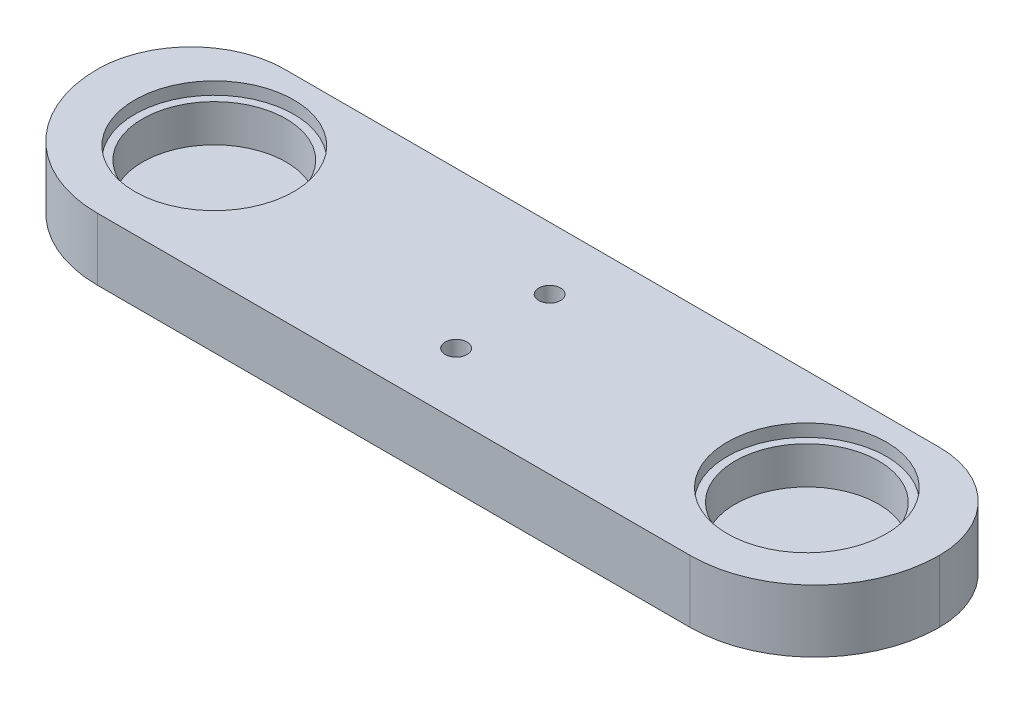
from build123d import *

# Parameters (mm, degrees)
SKETCH1_W           = 135
SKETCH1_H           = 35
BOSS_EXTRUDE1_DEPTH = 10
FILLET1_R           = 20
SKETCH3_R           = 12.75
CUT_EXTRUDE1_DEPTH  = 2
SKETCH4_R           = 11.5
CUT_EXTRUDE2_DEPTH  = 6
CUT_EXTRUDE3_REACH  = 93.483
SKETCH5_R           = 1.75
SKETCH6_R           = 3.1
CUT_EXTRUDE4_DEPTH  = 4
FILLET2_R           = 15


with BuildPart() as part:
    # Sketch1 → Boss-Extrude1 (new body)
    with BuildSketch(Plane(origin=(0, 0, 0), x_dir=(1, 0, 0), z_dir=(0, 1, 0))):
        with Locations((19.749798241, -8.123070146)):
            Rectangle(SKETCH1_W, SKETCH1_H)
    extrude(amount=BOSS_EXTRUDE1_DEPTH)

    # Fillet1
    fillet1_edges = [part.edges().sort_by_distance(p)[0] for p in [
        (87.249798241, 5, 25.623070146),
        (-47.750201759, 5, 25.623070146),
    ]]
    fillet(fillet1_edges, radius=FILLET1_R)

    # Sketch3 → Cut-Extrude1 (cut)
    with BuildSketch(Plane(origin=(0, 10, 0), x_dir=(1, 0, 0), z_dir=(0, 1, 0))):
        with Locations(Location((-27.750201759, -6.88629089, 0), (0, 0, 270))):
            Circle(SKETCH3_R)
        with Locations(Location((67.249798241, -6.88629089, 0), (0, 0, 90))):
            Circle(SKETCH3_R)
    extrude(amount=-CUT_EXTRUDE1_DEPTH, mode=Mode.SUBTRACT)

    # Sketch4 → Cut-Extrude2 (cut)
    with BuildSketch(Plane(origin=(0, 8, 0), x_dir=(1, 0, 0), z_dir=(0, 1, 0))):
        with Locations(Location((-27.750201759, -6.88629089, 0), (0, 0, 270))):
            Circle(SKETCH4_R)
        with Locations(Location((67.249798241, -6.88629089, 0), (0, 0, 90))):
            Circle(SKETCH4_R)
    extrude(amount=-CUT_EXTRUDE2_DEPTH, mode=Mode.SUBTRACT)

    # Sketch5 → Cut-Extrude3 (cut, up to next)
    with BuildSketch(Plane(origin=(0, 10, 0), x_dir=(1, 0, 0), z_dir=(0, 1, 0)), mode=Mode.PRIVATE) as cut_extrude3_sk1:
        with Locations(Location((19.749798241, -0.623070146, 0), (0, 0, 270))):
            Circle(SKETCH5_R)
    cut_extrude3_tool1 = extrude(cut_extrude3_sk1.sketch, amount=-CUT_EXTRUDE3_REACH, mode=Mode.PRIVATE) & part.part
    # Sketch5 → Cut-Extrude3 (cut, up to next)
    with BuildSketch(Plane(origin=(0, 10, 0), x_dir=(1, 0, 0), z_dir=(0, 1, 0)), mode=Mode.PRIVATE) as cut_extrude3_sk2:
        with Locations(Location((19.749798241, -15.623070146, 0), (0, 0, 270))):
            Circle(SKETCH5_R)
    cut_extrude3_tool2 = extrude(cut_extrude3_sk2.sketch, amount=-CUT_EXTRUDE3_REACH, mode=Mode.PRIVATE) & part.part
    add(cut_extrude3_tool1.solids().sort_by_distance((19.749798, 10, 0.62307))[0], mode=Mode.SUBTRACT)
    add(cut_extrude3_tool2.solids().sort_by_distance((19.749798, 10, 15.62307))[0], mode=Mode.SUBTRACT)

    # Sketch6 → Cut-Extrude4 (cut)
    with BuildSketch(Plane.XZ):
        with Locations(Location((19.749798241, 15.623070146, 0), (0, 0, 270))):
            Circle(SKETCH6_R)
        with Locations(Location((19.749798241, 0.623070146, 0), (0, 0, 270))):
            Circle(SKETCH6_R)
    extrude(amount=-CUT_EXTRUDE4_DEPTH, mode=Mode.SUBTRACT)

    # Fillet2
    fillet2_edges = [part.edges().sort_by_distance(p)[0] for p in [
        (-47.750201759, 5, -9.376929854),
        (87.249798241, 5, -9.376929854),
    ]]
    fillet(fillet2_edges, radius=FILLET2_R - 0.0001)  # a hair under: the kernel refuses the full size


solid = part.part
